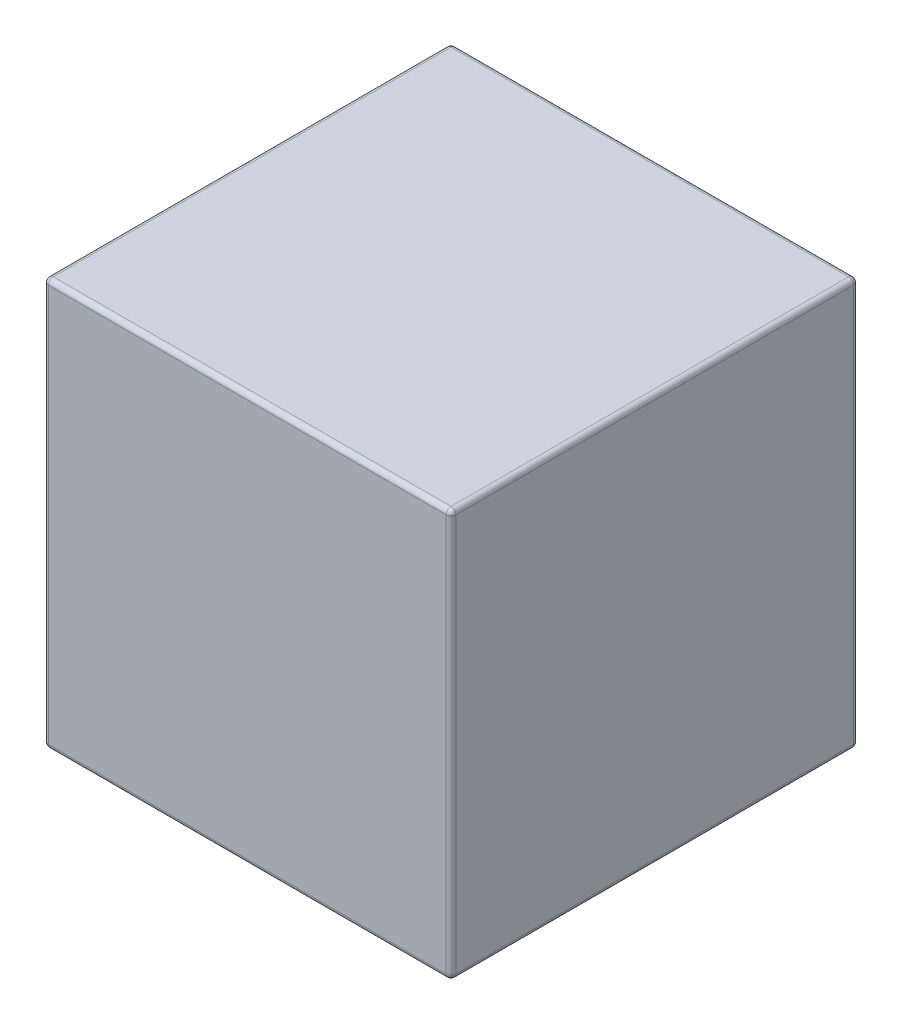
from build123d import *

# Parameters (mm, degrees)
ESQUISSE1_W             = 42
ESQUISSE1_H             = 42
BOSS_EXTRU_1_DEPTH      = 42
ESQUISSE2_W             = 10.5
ESQUISSE2_H             = 10.5
ENL_V_MAT_EXTRU_1_DEPTH = 4.5
CONG_1_R                = 0.5


with BuildPart() as part:
    # Esquisse1 → Boss.-Extru.1 (new body)
    with BuildSketch(Plane.XY):
        with Locations((21, -21)):
            Rectangle(ESQUISSE1_W, ESQUISSE1_H)
    extrude(amount=BOSS_EXTRU_1_DEPTH)

    # Esquisse2 → Enlèv. mat.-Extru.1 (cut)
    with BuildSketch(Plane.XZ.offset(42)):
        with Locations((33, 33)):
            Rectangle(ESQUISSE2_W, ESQUISSE2_H)
        with Locations((33, 9)):
            Rectangle(ESQUISSE2_W, ESQUISSE2_H)
    enl_v_mat_extru_1 = extrude(amount=-ENL_V_MAT_EXTRU_1_DEPTH, mode=Mode.SUBTRACT)

    # Congé1
    cong_1_edges = [part.edges().sort_by_distance(p)[0] for p in [
        (0, -42, 21),
        (21, -42, 42),
        (0, -21, 42),
        (42, -42, 21),
        (42, -21, 42),
        (21, -42, 0),
        (42, -21, 0),
        (0, -21, 0),
        (42, 0, 21),
        (21, 0, 42),
        (0, 0, 21),
        (21, 0, 0),
    ]]
    fillet(cong_1_edges, radius=CONG_1_R)

    # Symétrie1: Enlèv. mat.-Extru.1 across plane
    add(enl_v_mat_extru_1.mirror(Plane(origin=(21, 0, 0), x_dir=(0, 0, 1), z_dir=(1, 0, 0))), mode=Mode.SUBTRACT)


solid = part.part
